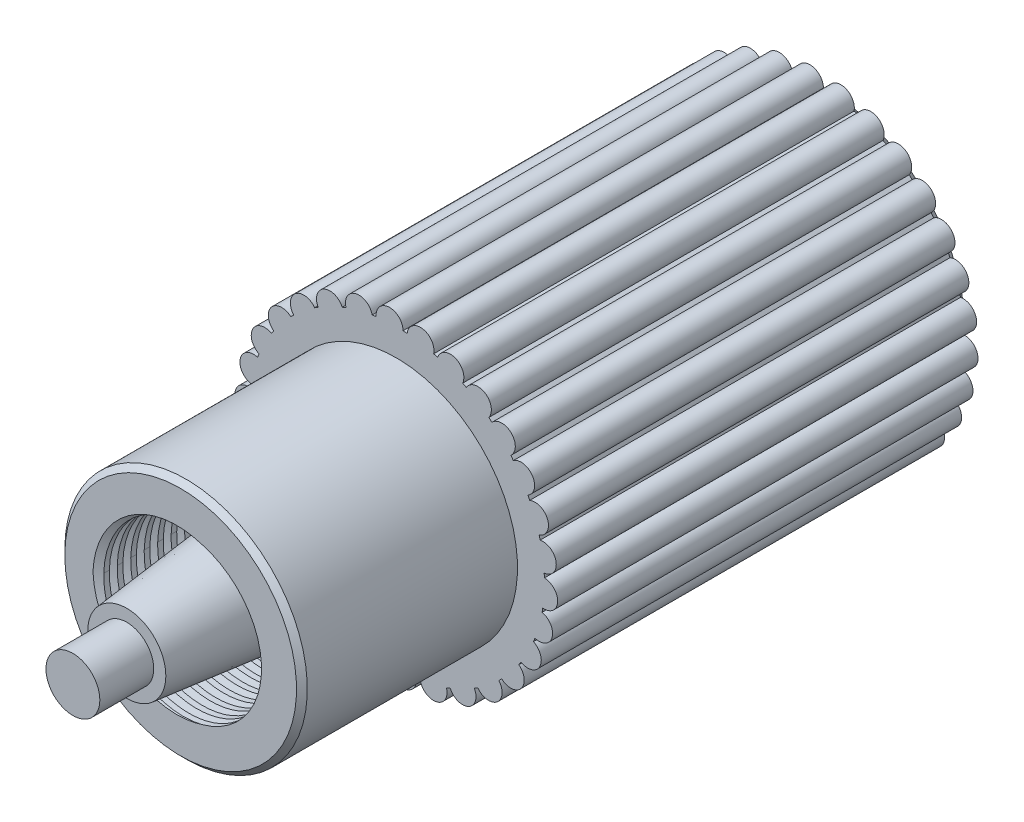
from build123d import *

# Parameters (mm, degrees)
SKETCH1_R           = 1.25
BOSS_EXTRUDE1_DEPTH = 5
BOSS_EXTRUDE1_TAPER = 6
SKETCH2_R           = 2.25
SKETCH2_R_2         = 1.5
BOSS_EXTRUDE2_DEPTH = 4
SKETCH3_R           = 2.75
BOSS_EXTRUDE3_DEPTH = 8
CUT_SWEEP1_PITCH    = 0.25
CHAMFER1_SIZE       = 0.1
SKETCH6_R           = 0.5
BOSS_EXTRUDE4_DEPTH = 1
CHAMFER2_SIZE       = 0.2
BOSS_EXTRUDE5_DEPTH = 7.8
BOSS_EXTRUDE6_DEPTH = 0.1


with BuildPart() as part:
    # Sketch1 → Boss-Extrude1 (new body)
    with BuildSketch(Plane.XY):
        Circle(SKETCH1_R)
    extrude(amount=BOSS_EXTRUDE1_DEPTH, taper=BOSS_EXTRUDE1_TAPER)



with BuildPart() as body_2:
    # Sketch2 → Boss-Extrude2 (new body)
    with BuildSketch(Plane(origin=(0, 0, 0), x_dir=(-1, 0, 0), z_dir=(0, 0, -1))):
        Circle(SKETCH2_R)
        Circle(SKETCH2_R_2, mode=Mode.SUBTRACT)
    extrude(amount=-BOSS_EXTRUDE2_DEPTH)


with BuildPart() as part_1:
    add(part.part)

    add(body_2.part)  # Boss-Extrude3 merges body 2
    # Sketch3 → Boss-Extrude3 (add)
    with BuildSketch(Plane(origin=(0, 0, 0), x_dir=(-1, 0, 0), z_dir=(0, 0, -1))):
        Circle(SKETCH3_R)
    extrude(amount=BOSS_EXTRUDE3_DEPTH)

    # Cut-Sweep1: arcs per turn and ends read off the stored shape
    # Cut-Sweep1: the profile of Sketch5 screwed along a right-hand helix through 16.5 turns, 6 arcs to a turn; built about Z, then put on its axis
    cut_sweep1_z = Axis((0, 0, 0), (0, 0, 1))
    cut_sweep1_corners = [(1.43649147, 0.002916815, -0.359961321), (1.43649147, -0.002916815, -0.140038679), (1.627017059, 0, -0.25)]
    with BuildLine(mode=Mode.PRIVATE) as cut_sweep1_profile:
        Line(cut_sweep1_corners[0], cut_sweep1_corners[1])
        Line(cut_sweep1_corners[1], cut_sweep1_corners[2])
        Line(cut_sweep1_corners[2], cut_sweep1_corners[0])
    cut_sweep1_cap = Face(cut_sweep1_profile.wire())
    cut_sweep1_turn_angles = [0, 30, 60, 90, 120, 150, 180, 210, 240, 270, 300, 330, 360]
    cut_sweep1_turn_weights = [1, 0.8660254037844387, 1, 0.8660254037844387, 1, 0.8660254037844387, 1, 0.8660254037844387, 1, 0.8660254037844387, 1, 0.8660254037844387, 1]
    cut_sweep1_turn_rails = [Edge.make_bspline([Vector(p[0], p[1], 0).rotate(cut_sweep1_z, cut_sweep1_turn_angles[k]) / cut_sweep1_turn_weights[k] + Vector(0, 0, p[2] + CUT_SWEEP1_PITCH * cut_sweep1_turn_angles[k] / 360) for k in range(13)], [0, 0, 0, 1, 1, 2, 2, 3, 3, 4, 4, 5, 5, 6, 6, 6], 2, cut_sweep1_turn_weights) for p in cut_sweep1_corners]
    cut_sweep1_turn_sides = [Face.make_surface_from_curves(cut_sweep1_turn_rails[p[0]], cut_sweep1_turn_rails[p[1]]) for p in [(0, 1), (1, 2), (2, 0)]]
    cut_sweep1_last_angles = [5760, 5790, 5820, 5850, 5880, 5910, 5940]
    cut_sweep1_last_weights = [1, 0.8660254037844387, 1, 0.8660254037844387, 1, 0.8660254037844387, 1]
    cut_sweep1_last_rails = [Edge.make_bspline([Vector(p[0], p[1], 0).rotate(cut_sweep1_z, cut_sweep1_last_angles[k]) / cut_sweep1_last_weights[k] + Vector(0, 0, p[2] + CUT_SWEEP1_PITCH * cut_sweep1_last_angles[k] / 360) for k in range(7)], [0, 0, 0, 1, 1, 2, 2, 3, 3, 3], 2, cut_sweep1_last_weights) for p in cut_sweep1_corners]
    cut_sweep1_last_sides = [Face.make_surface_from_curves(cut_sweep1_last_rails[p[0]], cut_sweep1_last_rails[p[1]]) for p in [(0, 1), (1, 2), (2, 0)]]
    cut_sweep1 = Plane(origin=(0, 0, 4), x_dir=(-1, 0, 0), z_dir=(0, 0, -1)) * Solid(Shell([*[p.moved(Location((0, 0, CUT_SWEEP1_PITCH * i))) for i in range(16) for p in cut_sweep1_turn_sides], *cut_sweep1_last_sides, cut_sweep1_cap, cut_sweep1_cap.rotate(cut_sweep1_z, 5940).moved(Location((0, 0, CUT_SWEEP1_PITCH * 5940 / 360)))]))
    add(cut_sweep1, mode=Mode.SUBTRACT)

    # Chamfer1
    chamfer1_edges = [part_1.edges().sort_by_distance(p)[0] for p in [
        (2.25, 0, 4),
    ]]
    chamfer(chamfer1_edges, length=CHAMFER1_SIZE)

    # Sketch6 → Boss-Extrude4 (add)
    with BuildSketch(Plane.XY.offset(5)):
        Circle(SKETCH6_R)
    extrude(amount=BOSS_EXTRUDE4_DEPTH)

    # Chamfer2
    chamfer2_edges = [part_1.edges().sort_by_distance(p)[0] for p in [
        (2.75, 0, -8),
    ]]
    chamfer(chamfer2_edges, length=CHAMFER2_SIZE)

    # Sketch7 → Boss-Extrude5 (add)
    with BuildSketch(Plane.XY):
        with BuildLine():
            ThreePointArc((-2.442271532, -1.264045), (-2.317385093, -1.480616875), (-2.17334671, -1.684952248))
            ThreePointArc((-2.17334671, -1.684952248), (-2.528056465, -1.61521841), (-2.442271532, -1.264045))
        make_face()
        with BuildLine():
            ThreePointArc((-2.573567132, 0.969150254), (-2.891941158, 0.797920007), (-2.706416346, 0.487658243))
            ThreePointArc((-2.706416346, 0.487658243), (-2.650946062, 0.731426673), (-2.573567132, 0.969150254))
        make_face()
        with BuildLine():
            ThreePointArc((-2.315830848, 1.48304669), (-2.662848408, 1.381751916), (-2.545884806, 1.039697338))
            ThreePointArc((-2.545884806, 1.039697338), (-2.440944374, 1.266605923), (-2.315830848, 1.48304669))
        make_face()
        with BuildLine():
            ThreePointArc((-1.956881643, 1.932126869), (-2.317376404, 1.905194636), (-2.274085883, 1.546296672))
            ThreePointArc((-2.274085883, 1.546296672), (-2.124261704, 1.746428417), (-1.956881643, 1.932126869))
        make_face()
        with BuildLine():
            ThreePointArc((-1.512407319, 2.296763832), (-1.870623931, 2.345371209), (-1.902898495, 1.98531542))
            ThreePointArc((-1.902898495, 1.98531542), (-1.714738604, 2.149923608), (-1.512407319, 2.296763832))
        make_face()
        with BuildLine():
            ThreePointArc((-1.001833539, 2.561021195), (-1.342116217, 2.683043805), (-1.448545311, 2.337566359))
            ThreePointArc((-1.448545311, 2.337566359), (-1.230273199, 2.459456821), (-1.001833539, 2.561021195))
        make_face()
        with BuildLine():
            ThreePointArc((-0.447474826, 2.713349642), (-0.754951583, 2.903454513), (-0.930883747, 2.58765443))
            ThreePointArc((-0.930883747, 2.58765443), (-0.692038951, 2.66149997), (-0.447474826, 2.713349642))
        make_face()
        with BuildLine():
            ThreePointArc((0.126440685, 2.74709169), (-0.134791943, 2.996970326), (-0.372538096, 2.724649586))
            ThreePointArc((-0.372538096, 2.724649586), (-0.123559281, 2.747222798), (0.126440685, 2.74709169))
        make_face()
        with BuildLine():
            ThreePointArc((0.69483013, 2.660772649), (0.491258752, 2.959504154), (0.202089258, 2.742564481))
            ThreePointArc((0.202089258, 2.742564481), (0.450320523, 2.712878808), (0.69483013, 2.660772649))
        make_face()
        with BuildLine():
            ThreePointArc((1.232852165, 2.458165076), (1.095839082, 2.79269345), (0.767884341, 2.640616147))
            ThreePointArc((0.767884341, 2.640616147), (1.004519159, 2.559968996), (1.232852165, 2.458165076))
        make_face()
        with BuildLine():
            ThreePointArc((1.716992645, 2.148123893), (1.652525986, 2.503828641), (1.300119194, 2.423260217))
            ThreePointArc((1.300119194, 2.423260217), (1.514815488, 2.295176254), (1.716992645, 2.148123893))
        make_face()
        with BuildLine():
            ThreePointArc((2.126092307, 1.744199388), (2.136989575, 2.105534506), (1.775532599, 2.099996188))
            ThreePointArc((1.775532599, 2.099996188), (1.95890711, 1.930073297), (2.126092307, 1.744199388))
        make_face()
        with BuildLine():
            ThreePointArc((2.442271532, 1.264045), (2.528056465, 1.61521841), (2.17334671, 1.684952248))
            ThreePointArc((2.17334671, 1.684952248), (2.317385093, 1.480616875), (2.442271532, 1.264045))
        make_face()
        with BuildLine():
            ThreePointArc((2.651711773, 0.72864578), (2.808635156, 1.054309518), (2.476175141, 1.196267809))
            ThreePointArc((2.476175141, 1.196267809), (2.574582227, 0.966450391), (2.651711773, 0.72864578))
        make_face()
        with BuildLine():
            ThreePointArc((2.745259485, 0.161401243), (2.966463014, 0.447322241), (2.670782836, 0.655300727))
            ThreePointArc((2.670782836, 0.655300727), (2.719257763, 0.410045388), (2.745259485, 0.161401243))
        make_face()
        with BuildLine():
            ThreePointArc((2.718826184, -0.412897302), (2.994642203, -0.179215164), (2.748664505, 0.085693859))
            ThreePointArc((2.748664505, 0.085693859), (2.745088686, -0.164280567), (2.718826184, -0.412897302))
        make_face()
        with BuildLine():
            ThreePointArc((2.573567132, -0.969150254), (2.891941158, -0.797920007), (2.706416346, -0.487658243))
            ThreePointArc((2.706416346, -0.487658243), (2.650946062, -0.731426673), (2.573567132, -0.969150254))
        make_face()
        with BuildLine():
            ThreePointArc((2.315830848, -1.48304669), (2.662848408, -1.381751916), (2.545884806, -1.039697338))
            ThreePointArc((2.545884806, -1.039697338), (2.440944374, -1.266605923), (2.315830848, -1.48304669))
        make_face()
        with BuildLine():
            ThreePointArc((1.956881643, -1.932126869), (2.317376404, -1.905194636), (2.274085883, -1.546296672))
            ThreePointArc((2.274085883, -1.546296672), (2.124261704, -1.746428417), (1.956881643, -1.932126869))
        make_face()
        with BuildLine():
            ThreePointArc((1.512407319, -2.296763832), (1.870623931, -2.345371209), (1.902898495, -1.98531542))
            ThreePointArc((1.902898495, -1.98531542), (1.714738604, -2.149923608), (1.512407319, -2.296763832))
        make_face()
        with BuildLine():
            ThreePointArc((1.001833539, -2.561021195), (1.342116217, -2.683043805), (1.448545311, -2.337566359))
            ThreePointArc((1.448545311, -2.337566359), (1.230273199, -2.459456821), (1.001833539, -2.561021195))
        make_face()
        with BuildLine():
            ThreePointArc((0.447474826, -2.713349642), (0.754951583, -2.903454513), (0.930883747, -2.58765443))
            ThreePointArc((0.930883747, -2.58765443), (0.692038951, -2.66149997), (0.447474826, -2.713349642))
        make_face()
        with BuildLine():
            ThreePointArc((-0.126440685, -2.74709169), (0.134791943, -2.996970326), (0.372538096, -2.724649586))
            ThreePointArc((0.372538096, -2.724649586), (0.123559281, -2.747222798), (-0.126440685, -2.74709169))
        make_face()
        with BuildLine():
            ThreePointArc((-0.69483013, -2.660772649), (-0.491258752, -2.959504154), (-0.202089258, -2.742564481))
            ThreePointArc((-0.202089258, -2.742564481), (-0.450320523, -2.712878808), (-0.69483013, -2.660772649))
        make_face()
        with BuildLine():
            ThreePointArc((-1.232852165, -2.458165076), (-1.095839082, -2.79269345), (-0.767884341, -2.640616147))
            ThreePointArc((-0.767884341, -2.640616147), (-1.004519159, -2.559968996), (-1.232852165, -2.458165076))
        make_face()
        with BuildLine():
            ThreePointArc((-1.716992645, -2.148123893), (-1.652525986, -2.503828641), (-1.300119194, -2.423260217))
            ThreePointArc((-1.300119194, -2.423260217), (-1.514815488, -2.295176254), (-1.716992645, -2.148123893))
        make_face()
        with BuildLine():
            ThreePointArc((-2.126092307, -1.744199388), (-2.136989575, -2.105534506), (-1.775532599, -2.099996188))
            ThreePointArc((-1.775532599, -2.099996188), (-1.95890711, -1.930073297), (-2.126092307, -1.744199388))
        make_face()
        with BuildLine():
            ThreePointArc((-2.651711773, -0.72864578), (-2.808635156, -1.054309518), (-2.476175141, -1.196267809))
            ThreePointArc((-2.476175141, -1.196267809), (-2.574582227, -0.966450391), (-2.651711773, -0.72864578))
        make_face()
        with BuildLine():
            ThreePointArc((-2.745259485, -0.161401243), (-2.966463014, -0.447322241), (-2.670782836, -0.655300727))
            ThreePointArc((-2.670782836, -0.655300727), (-2.719257763, -0.410045388), (-2.745259485, -0.161401243))
        make_face()
        with BuildLine():
            ThreePointArc((-2.718826184, 0.412897302), (-2.994642203, 0.179215164), (-2.748664505, -0.085693859))
            ThreePointArc((-2.748664505, -0.085693859), (-2.745088686, 0.164280567), (-2.718826184, 0.412897302))
        make_face()
    extrude(amount=-BOSS_EXTRUDE5_DEPTH)

    # Sketch8 → Boss-Extrude6 (add)
    with BuildSketch(Plane(origin=(0, 0, -8), x_dir=(-1, 0, 0), z_dir=(0, 0, -1))):
        with BuildLine():
            add(Edge.make_bspline(
                [(-2.14280695, 0.340346062), (-1.947793971, 0.668416956), (-1.673621886, 1.145813579)],
                knots=[0, 0, 0, 1, 1, 1], degree=2))
            add(Edge.make_bspline(
                [(-1.673621886, 1.145813579), (-1.661895463, 0.76183074), (-1.518153798, 0.328954034)],
                knots=[0, 0, 0, 1, 1, 1], degree=2))
            add(Edge.make_bspline(
                [(-1.681317077, 0.398899082), (-1.602948273, 0.373760735), (-1.518153798, 0.328954034)],
                knots=[0.774028944, 0.774028944, 0.774028944, 1, 1, 1], degree=2))
            add(Edge.make_bspline(
                [(-1.681317077, 0.398899082), (-1.348778638, -1.555873402), (0.608158506, -1.809270486), (1.474783923, -0.07805845)],
                knots=[0, 0, 0, 0, 1, 1, 1, 1], degree=3))
            add(Edge.make_bspline(
                [(2.164313847, -0.638520531), (1.346212131, -0.936566908), (1.474783923, -0.07805845)],
                knots=[0, 0, 0, 1, 1, 1], degree=2))
            add(Edge.make_bspline(
                [(-1.967947714, 0.421025179), (-2.022208133, -2.844149017), (1.545563758, -2.564003056), (2.164313847, -0.638520531)],
                knots=[0, 0, 0, 0, 1, 1, 1, 1], degree=3))
            add(Edge.make_bspline(
                [(-2.14280695, 0.340346062), (-2.088925329, 0.380721869), (-2.030638809, 0.407614931), (-1.967947714, 0.421025179)],
                knots=[0, 0, 0, 0, 0.324055757, 0.324055757, 0.324055757, 0.324055757], degree=3))
        make_face()
    extrude(amount=BOSS_EXTRUDE6_DEPTH)


solid = part_1.part
